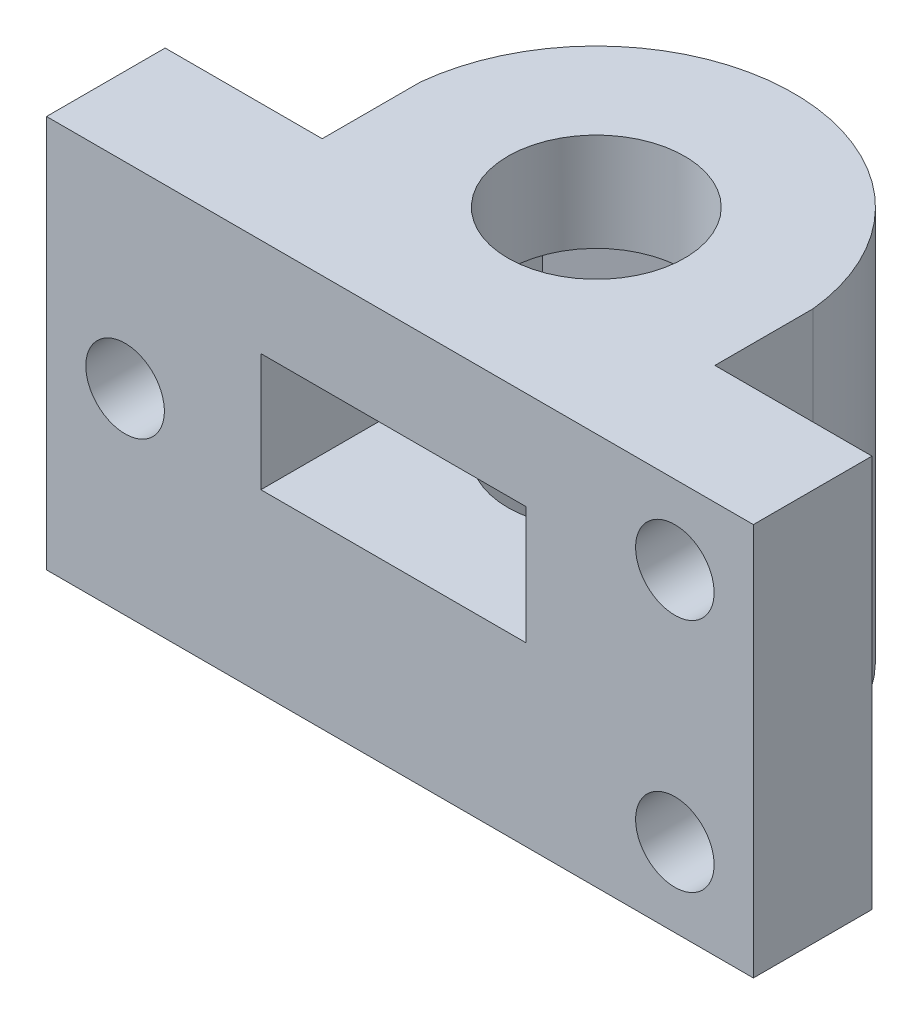
from build123d import *

# Parameters (mm, degrees)
SKETCH1_R           = 4.5
BOSS_EXTRUDE1_DEPTH = 20
CUT_EXTRUDE2_DEPTH  = 6
SKETCH9_R           = 2
CUT_EXTRUDE4_DEPTH  = 38.153619425
SKETCH10_W          = 13.49308662
SKETCH10_H          = 6.005400944
CUT_EXTRUDE5_DEPTH  = 10


with BuildPart() as part:
    # Sketch1 → Boss-Extrude1 (new body)
    with BuildSketch(Plane(origin=(0, 0, 0), x_dir=(1, 0, 0), z_dir=(0, 1, 0))):
        with BuildLine():
            Line((0, 0), (20, 0))
            Line((20, 0), (28, 0))
            Line((28, 0), (28, 6.039957232))
            Line((28, 6.039957232), (20, 6.039957232))
            Line((20, 6.039957232), (20, 11.039957232))
            ThreePointArc((20, 11.039957232), (10, 20.053930129), (0, 11.039957232))
            Line((0, 11.039957232), (0, 6.039957232))
            Line((0, 6.039957232), (-8, 6.039957232))
            Line((-8, 6.039957232), (-8, 0))
            Line((-8, 0), (0, 0))
        make_face()
        with Locations((10, 10)):
            Circle(SKETCH1_R, mode=Mode.SUBTRACT)
    extrude(amount=BOSS_EXTRUDE1_DEPTH)

    # Sketch4 → Cut-Extrude2 (cut)
    with BuildSketch(Plane(origin=(0, 15, 0), x_dir=(1, 0, 0), z_dir=(0, 1, 0))):
        Polygon((10, 2.494446501), (16.5, 6.24722325), (16.5, 13.75277675), (10, 17.505553499), (3.5, 13.75277675), (3.5, 6.24722325), align=None)
    extrude(amount=-CUT_EXTRUDE2_DEPTH, mode=Mode.SUBTRACT)

    # Sketch9 → Cut-Extrude4 (cut, through all)
    with BuildSketch(Plane(origin=(0, 0, -6.039957232), x_dir=(-1, 0, 0), z_dir=(0, 0, -1))):
        with Locations((-24, 4)):
            Circle(SKETCH9_R)
        with Locations((-24, 16)):
            Circle(SKETCH9_R)
        with Locations((4, 10)):
            Circle(SKETCH9_R)
    extrude(amount=-CUT_EXTRUDE4_DEPTH, mode=Mode.SUBTRACT)

    # Sketch10 → Cut-Extrude5 (cut)
    with BuildSketch(Plane(origin=(0, 0, -6.24722325), x_dir=(-1, 0, 0), z_dir=(0, 0, -1))):
        with Locations((-9.663877352, 11.998541172)):
            Rectangle(SKETCH10_W, SKETCH10_H)
    extrude(amount=-CUT_EXTRUDE5_DEPTH, mode=Mode.SUBTRACT)


solid = part.part
